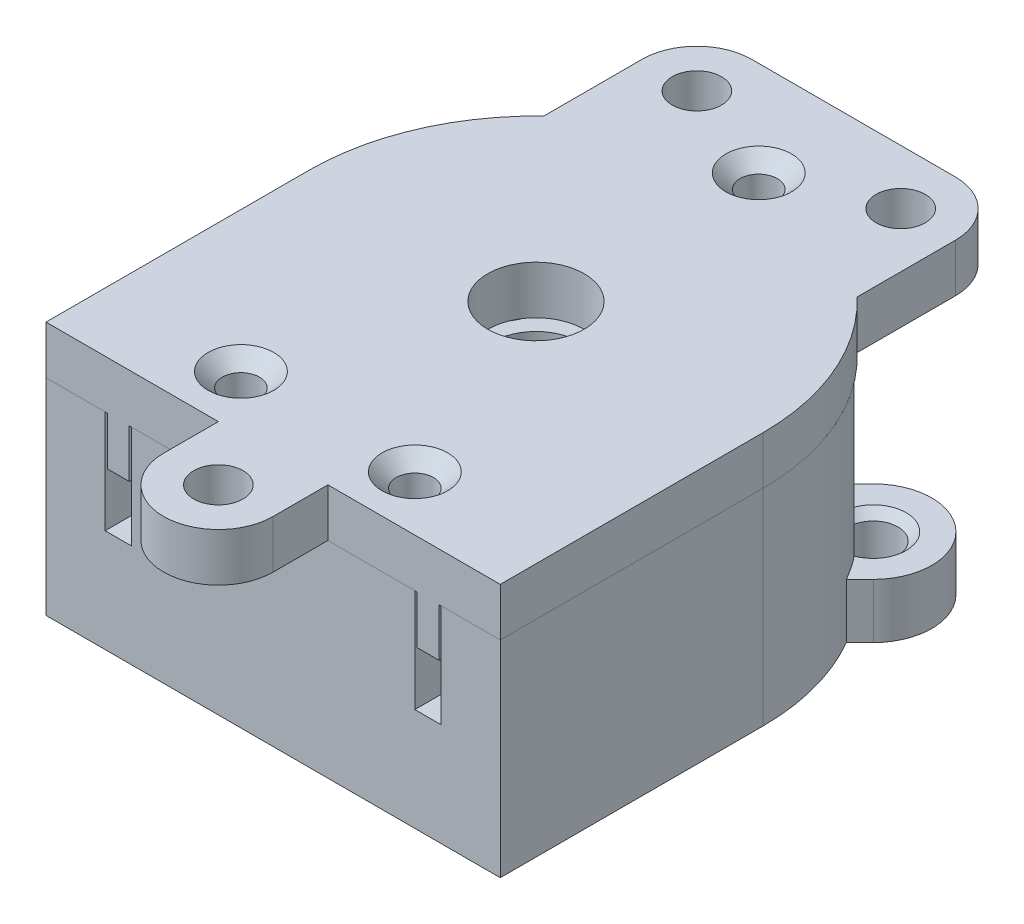
from build123d import *
from build123d.topology import SkipClean

# Parameters (mm, degrees)
BOSS_EXTRUDE1_DEPTH                         = 3.7
SKETCH2_R                                   = 1.25
SKETCH2_R_2                                 = 0.585
BOSS_EXTRUDE2_DEPTH                         = 1
BOSS_EXTRUDE2_2_DEPTH                       = 1
BOSS_EXTRUDE2_3_DEPTH                       = 1
BOSS_EXTRUDE3_START                         = 1.2
SKETCH4_R                                   = 6.435
BOSS_EXTRUDE3_DEPTH                         = 1.2
SKETCH5_R                                   = 6.435
BOSS_EXTRUDE4_DEPTH                         = 1.2
BOSS_EXTRUDE5_START                         = 1
SKETCH7_R                                   = 1.25
SKETCH7_R_2                                 = 0.585
BOSS_EXTRUDE5_DEPTH                         = 1
BOSS_EXTRUDE6_START                         = -1.6
BOSS_EXTRUDE6_DEPTH                         = 6.9
SKETCH9_R                                   = 10.37
SKETCH9_W                                   = 20.74
SKETCH9_H                                   = 12
BOSS_EXTRUDE7_DEPTH                         = 2.5
SKETCH10_R                                  = 10.37
SKETCH10_W                                  = 20.74
SKETCH10_H                                  = 12
BOSS_EXTRUDE8_DEPTH                         = 2.2
BOSS_EXTRUDE9_DEPTH                         = 2.5
SKETCH26_R                                  = 8.2
CUT_EXTRUDE4_DEPTH                          = 1.6
SKETCH27_R                                  = 2.2
CUT_EXTRUDE5_DEPTH                          = 19.285155181
SKETCH28_R                                  = 1.5
CUT_EXTRUDE6_DEPTH                          = 19.089414031
SKETCH30_R                                  = 6.635
BOSS_EXTRUDE10_DEPTH                        = 2.2
CUT_EXTRUDE3_START                          = -6.9
SKETCH25_R                                  = 1.6
CUT_EXTRUDE3_DEPTH                          = 9.1
CSK_FOR_1_FLAT_HEAD_MACHINE_SCREW_2_COUNT   = 2
CSK_FOR_1_FLAT_HEAD_MACHINE_SCREW_2_PITCH   = 7.304924281
CSK_FOR_1_FLAT_HEAD_MACHINE_SCREW_3_COUNT   = 2
CSK_FOR_1_FLAT_HEAD_MACHINE_SCREW_3_PITCH   = 7.304924281
CSK_FOR_1_FLAT_HEAD_MACHINE_SCREW_4_A_COUNT = 2
CSK_FOR_1_FLAT_HEAD_MACHINE_SCREW_4_A_PITCH = 15.4
CSK_FOR_1_FLAT_HEAD_MACHINE_SCREW_5_COUNT   = 2
CSK_FOR_1_FLAT_HEAD_MACHINE_SCREW_5_PITCH   = 21.778888861
CSK_FOR_1_FLAT_HEAD_MACHINE_SCREW_6_COUNT   = 2
CSK_FOR_1_FLAT_HEAD_MACHINE_SCREW_6_PITCH   = 15.4
SKETCH36_R                                  = 7.57
SKETCH36_R_2                                = 6.735
BOSS_EXTRUDE11_DEPTH                        = 2.2
SKETCH37_R                                  = 2.2
CUT_EXTRUDE7_DEPTH                          = 2.2
FILLET1_R                                   = 1
SKETCH40_R                                  = 2.5
BOSS_EXTRUDE12_DEPTH                        = 2.2
BOSS_EXTRUDE13_REACH                        = 22.066
CSK_FOR_1_FLAT_HEAD_MACHINE_SCREW_7_A_COUNT = 2
CSK_FOR_1_FLAT_HEAD_MACHINE_SCREW_7_A_PITCH = 20.066633998
CSK_FOR_1_FLAT_HEAD_MACHINE_SCREW_8_COUNT   = 2
CSK_FOR_1_FLAT_HEAD_MACHINE_SCREW_8_PITCH   = 20.066633998
BOSS_EXTRUDE14_DEPTH                        = 2.2
BOSS_EXTRUDE15_DEPTH                        = 2.2


# Read off the part's stored shape, not the designer's step: Boss-Extrude6, CSK for #1 Flat Head Machine Screw (100)5
with BuildPart() as part:
    # Sketch1 → Boss-Extrude1 (new body)
    with BuildSketch(Plane(origin=(0, 0, 0), x_dir=(1, 0, 0), z_dir=(0, 1, 0))):
        with BuildLine():
            ThreePointArc((-1.322875656, -1.5), (-1.547786782, -1.266631784), (-1.732050808, -1))
            Line((-1.732050808, -1), (-2.598076211, -1.5))
            ThreePointArc((-2.598076211, -1.5), (-2.379793788, -2.026980386), (-2.305341719, -2.5925))
            ThreePointArc((-2.305341719, -2.5925), (-2.88570421, -4.075525106), (-4.318489055, -4.770731315))
            ThreePointArc((-4.318489055, -4.770731315), (0, -6.435), (4.318489055, -4.770731315))
            ThreePointArc((4.318489055, -4.770731315), (2.556545765, -3.609681503), (2.598076211, -1.5))
            Line((2.598076211, -1.5), (1.732050808, -1))
            ThreePointArc((1.732050808, -1), (1.547786782, -1.266631784), (1.322875656, -1.5))
            ThreePointArc((1.322875656, -1.5), (0, -2), (-1.322875656, -1.5))
        make_face()
        with BuildLine():
            Line((0, 3), (0, 2))
            ThreePointArc((0, 2), (1.414213562, 1.414213562), (2, 0))
            ThreePointArc((2, 0), (1.931851653, -0.51763809), (1.732050808, -1))
            Line((1.732050808, -1), (2.598076211, -1.5))
            ThreePointArc((2.598076211, -1.5), (4.404348764, -0.409192827), (6.290819041, -1.35455557))
            ThreePointArc((6.290819041, -1.35455557), (6.398853238, -0.681103689), (6.435, 0))
            ThreePointArc((6.435, 0), (5.201017615, 3.789279717), (1.972329986, 6.125286885))
            ThreePointArc((1.972329986, 6.125286885), (2.1311694, 5.667018662), (2.185, 5.185))
            ThreePointArc((2.185, 5.185), (1.545028317, 3.639971683), (0, 3))
        make_face()
        with BuildLine():
            ThreePointArc((-1.732050808, -1), (-1.732050808, 1), (0, 2))
            Line((0, 2), (0, 3))
            ThreePointArc((0, 3), (-1.847802999, 4.01887433), (-1.972329986, 6.125286885))
            ThreePointArc((-1.972329986, 6.125286885), (-5.572873473, 3.2175), (-6.290819041, -1.35455557))
            ThreePointArc((-6.290819041, -1.35455557), (-4.404348764, -0.409192827), (-2.598076211, -1.5))
            Line((-2.598076211, -1.5), (-1.732050808, -1))
        make_face()
        with BuildLine():
            Line((1.322875656, -1.5), (0, -1.5))
            Line((0, -1.5), (-1.322875656, -1.5))
            ThreePointArc((-1.322875656, -1.5), (0, -2), (1.322875656, -1.5))
        make_face()
    extrude(amount=BOSS_EXTRUDE1_DEPTH)



with BuildPart() as body_2:
    # Sketch2 → Boss-Extrude2 (new body)
    with BuildSketch(Plane.XZ):
        with Locations(Location((-4.490341719, 2.5925, 0), (0, 0, 270))):
            Circle(SKETCH2_R)
        with Locations(Location((-4.490341719, 2.5925, 0), (0, 0, 270))):
            Circle(SKETCH2_R_2, mode=Mode.SUBTRACT)
    extrude(amount=-BOSS_EXTRUDE2_DEPTH)


with BuildPart() as body_3:
    # Sketch2 → Boss-Extrude2 2 (new body)
    with BuildSketch(Plane.XZ):
        with Locations(Location((4.490341719, 2.5925, 0), (0, 0, 270))):
            Circle(SKETCH2_R)
        with Locations(Location((4.490341719, 2.5925, 0), (0, 0, 270))):
            Circle(SKETCH2_R_2, mode=Mode.SUBTRACT)
    extrude(amount=-BOSS_EXTRUDE2_2_DEPTH)


with BuildPart() as body_4:
    # Sketch2 → Boss-Extrude2 3 (new body)
    with BuildSketch(Plane.XZ):
        with Locations(Location((0, -5.185, 0), (0, 0, 270))):
            Circle(SKETCH2_R)
        with Locations(Location((0, -5.185, 0), (0, 0, 270))):
            Circle(SKETCH2_R_2, mode=Mode.SUBTRACT)
    extrude(amount=-BOSS_EXTRUDE2_3_DEPTH)


with BuildPart() as part_1:
    with SkipClean():  # the faces are left unmerged after this step: merging them gives an invalid solid
        add(part.part)

        add(body_2.part)  # Boss-Extrude3 merges body 2

        add(body_3.part)  # Boss-Extrude3 merges body 3

        add(body_4.part)  # Boss-Extrude3 merges body 4
        # Sketch4 → Boss-Extrude3 (add)
        with BuildSketch(Plane.XZ.offset(BOSS_EXTRUDE3_START)):
            with Locations(Location((0, 0, 0), (0, 0, 270))):
                Circle(SKETCH4_R)
        extrude(amount=-BOSS_EXTRUDE3_DEPTH)


with BuildPart() as body_2_2:
    # Sketch5 → Boss-Extrude4 (new body)
    with BuildSketch(Plane(origin=(0, 3.7, 0), x_dir=(1, 0, 0), z_dir=(0, 1, 0))):
        with Locations(Location((0, 0, 0), (0, 0, 270))):
            Circle(SKETCH5_R)
    extrude(amount=BOSS_EXTRUDE4_DEPTH)

    # Sketch7 → Boss-Extrude5 (add)
    # profile 1 of 3: a face of its own
    with BuildSketch(Plane.XZ.offset(-3.7).offset(BOSS_EXTRUDE5_START)):
        with Locations(Location((0, -5.185, 0), (0, 0, 270))):
            Circle(SKETCH7_R)
        with Locations(Location((0, -5.185, 0), (0, 0, 270))):
            Circle(SKETCH7_R_2, mode=Mode.SUBTRACT)
    # profile 2 of 3: a face of its own
    with BuildSketch(Plane.XZ.offset(-3.7).offset(BOSS_EXTRUDE5_START)):
        with Locations(Location((-4.490341719, 2.5925, 0), (0, 0, 149.999192618))):
            Circle(SKETCH7_R)
        with Locations(Location((-4.490341719, 2.5925, 0), (0, 0, 270))):
            Circle(SKETCH7_R_2, mode=Mode.SUBTRACT)
    # profile 3 of 3: a face of its own
    with BuildSketch(Plane.XZ.offset(-3.7).offset(BOSS_EXTRUDE5_START)):
        with Locations(Location((4.490341719, 2.5925, 0), (0, 0, 29.999192618))):
            Circle(SKETCH7_R)
        with Locations(Location((4.490341719, 2.5925, 0), (0, 0, 270))):
            Circle(SKETCH7_R_2, mode=Mode.SUBTRACT)
    extrude(amount=-BOSS_EXTRUDE5_DEPTH)


with BuildPart() as body_3_2:
    # Boss-Extrude6 outline → Boss-Extrude6 (new body)
    with BuildSketch(Plane(origin=(0, 0, 0), x_dir=(1, 0, 0), z_dir=(0, 1, 0)).offset(BOSS_EXTRUDE6_START)):
        with BuildLine():
            Line((-10.37, -12), (-7.67, -12))
            Line((-7.67, -12), (-7.67, 0))
            ThreePointArc((-7.67, 0), (0, 7.67), (7.67, 0))
            Line((7.67, 0), (7.67, -12))
            Line((7.67, -12), (10.37, -12))
            Line((10.37, -12), (10.37, 0))
            ThreePointArc((10.37, 0), (0, 10.37), (-10.37, 0))
            Line((-10.37, 0), (-10.37, -12))
        make_face()
        with BuildLine():
            Line((6.47, -12), (6.47, -4.119223228))
            ThreePointArc((6.47, -4.119223228), (0, -7.67), (-6.47, -4.119223228))
            Line((-6.47, -4.119223228), (-6.47, -12))
            Line((-6.47, -12), (6.47, -12))
        make_face()
    extrude(amount=BOSS_EXTRUDE6_DEPTH)

    # Sketch9 → Boss-Extrude7 (add)
    with BuildSketch(Plane(origin=(0, -1.6, 0), x_dir=(1, 0, 0), z_dir=(0, 1, 0))):
        Circle(SKETCH9_R)
        with Locations((0, -6)):
            Rectangle(SKETCH9_W, SKETCH9_H)
    extrude(amount=-BOSS_EXTRUDE7_DEPTH)

    # Sketch24 → Boss-Extrude9 (add)
    with BuildSketch(Plane.XZ.offset(4.1)):
        with BuildLine():
            ThreePointArc((-8.903418523, -5.316581477), (-9.265421569, -5.537049397), (-9.587975106, -5.812024894))
            Line((-9.587975106, -5.812024894), (-5.812024894, -9.587975106))
            ThreePointArc((-5.812024894, -9.587975106), (-5.537049397, -9.265421569), (-5.316581477, -8.903418523))
            ThreePointArc((-5.316581477, -8.903418523), (-7.332697321, -7.332697321), (-8.903418523, -5.316581477))
        make_face()
        with BuildLine():
            Line((-8.973453212, -5.197503001), (-9.587975106, -5.812024894))
            ThreePointArc((-9.587975106, -5.812024894), (-9.265421569, -5.537049397), (-8.903418523, -5.316581477))
            ThreePointArc((-8.903418523, -5.316581477), (-8.938634162, -5.257158863), (-8.973453212, -5.197503001))
        make_face()
        with BuildLine():
            ThreePointArc((-5.316581477, -8.903418523), (-5.537049397, -9.265421569), (-5.812024894, -9.587975106))
            Line((-5.812024894, -9.587975106), (-5.197503001, -8.973453212))
            ThreePointArc((-5.197503001, -8.973453212), (-5.257158863, -8.938634162), (-5.316581477, -8.903418523))
        make_face()
        with BuildLine():
            Line((-5.812024894, -9.587975106), (-9.587975106, -5.812024894))
            ThreePointArc((-9.587975106, -5.812024894), (-9.587975106, -9.587975106), (-5.812024894, -9.587975106))
        make_face()
        with BuildLine():
            ThreePointArc((8.903418523, -5.316581477), (9.265421569, -5.537049397), (9.587975106, -5.812024894))
            Line((9.587975106, -5.812024894), (8.973453212, -5.197503001))
            ThreePointArc((8.973453212, -5.197503001), (8.938634162, -5.257158863), (8.903418523, -5.316581477))
        make_face()
        with BuildLine():
            ThreePointArc((5.316581477, -8.903418523), (5.537049397, -9.265421569), (5.812024894, -9.587975106))
            Line((5.812024894, -9.587975106), (9.587975106, -5.812024894))
            ThreePointArc((9.587975106, -5.812024894), (9.265421569, -5.537049397), (8.903418523, -5.316581477))
            ThreePointArc((8.903418523, -5.316581477), (7.332697321, -7.332697321), (5.316581477, -8.903418523))
        make_face()
        with BuildLine():
            ThreePointArc((5.316581477, -8.903418523), (5.257158863, -8.938634162), (5.197503001, -8.973453212))
            Line((5.197503001, -8.973453212), (5.812024894, -9.587975106))
            ThreePointArc((5.812024894, -9.587975106), (5.537049397, -9.265421569), (5.316581477, -8.903418523))
        make_face()
        with BuildLine():
            Line((9.587975106, -5.812024894), (5.812024894, -9.587975106))
            ThreePointArc((5.812024894, -9.587975106), (8.721764764, -10.166758352), (10.37, -7.7))
            ThreePointArc((10.37, -7.7), (10.166758352, -6.678235236), (9.587975106, -5.812024894))
        make_face()
    extrude(amount=-BOSS_EXTRUDE9_DEPTH)

    # Sketch26 → Cut-Extrude4 (cut)
    with BuildSketch(Plane.XZ.offset(4.1)):
        with Locations(Location((0, 0, 0), (0, 0, 270))):
            Circle(SKETCH26_R)
    extrude(amount=-CUT_EXTRUDE4_DEPTH, mode=Mode.SUBTRACT)

    # Sketch27 → Cut-Extrude5 (cut, through all)
    with BuildSketch(Plane(origin=(0, -1.6, 0), x_dir=(1, 0, 0), z_dir=(0, 1, 0))):
        with Locations(Location((0, 0, 0), (0, 0, 270))):
            Circle(SKETCH27_R)
    extrude(amount=-CUT_EXTRUDE5_DEPTH, mode=Mode.SUBTRACT)

    # Sketch30 → Boss-Extrude10 (add)
    # profile 1 of 3: a face of its own
    with BuildSketch(Plane(origin=(0, -1.6, 0), x_dir=(1, 0, 0), z_dir=(0, 1, 0))):
        with BuildLine():
            ThreePointArc((-6.47, -4.119223228), (-7.363891634, -2.145227261), (-7.67, 0))
            Line((-7.67, 0), (-7.67, -12))
            Line((-7.67, -12), (-6.47, -12))
            Line((-6.47, -12), (-6.47, -4.119223228))
        make_face()
    # profile 2 of 3: a face of its own
    with BuildSketch(Plane(origin=(0, -1.6, 0), x_dir=(1, 0, 0), z_dir=(0, 1, 0))):
        with BuildLine():
            ThreePointArc((7.67, 0), (0, 7.67), (-7.67, 0))
            ThreePointArc((-7.67, 0), (-7.363891634, -2.145227261), (-6.47, -4.119223228))
            ThreePointArc((-6.47, -4.119223228), (0, -7.67), (6.47, -4.119223228))
            ThreePointArc((6.47, -4.119223228), (7.363891634, -2.145227261), (7.67, 0))
        make_face()
        with Locations(Location((0, 0, 0), (0, 0, 270))):
            Circle(SKETCH30_R, mode=Mode.SUBTRACT)
    # profile 3 of 3: a face of its own
    with BuildSketch(Plane(origin=(0, -1.6, 0), x_dir=(1, 0, 0), z_dir=(0, 1, 0))):
        with BuildLine():
            Line((7.67, -12), (7.67, 0))
            ThreePointArc((7.67, 0), (7.363891634, -2.145227261), (6.47, -4.119223228))
            Line((6.47, -4.119223228), (6.47, -12))
            Line((6.47, -12), (7.67, -12))
        make_face()
    extrude(amount=BOSS_EXTRUDE10_DEPTH)

    # Sketch25 → Cut-Extrude3 (cut)
    with BuildSketch(Plane(origin=(0, 5.3, 0), x_dir=(1, 0, 0), z_dir=(0, 1, 0)).offset(CUT_EXTRUDE3_START)):
        with Locations((-7.7, 7.7)):
            Circle(SKETCH25_R)
        with Locations((7.7, 7.7)):
            Circle(SKETCH25_R)
        with Locations(Location((7.7, -7.7, 0), (0, 0, 270))):
            Circle(SKETCH25_R)
        with Locations(Location((-7.7, -7.7, 0), (0, 0, 270))):
            Circle(SKETCH25_R)
    extrude(amount=CUT_EXTRUDE3_DEPTH, mode=Mode.SUBTRACT)

    # Sketch34 → CSK for _1 Flat Head Machine Screw _ 4 (revolve, cut)
    with BuildSketch(Plane(origin=(-7.7, -1.6, 7.7), x_dir=(0, 0, 1), z_dir=(1, 0, 0))):
        Polygon((0, 0), (0, 4.1), (1.125000036, 4.1), (1.125000036, 0.374999504), (1.49999954, 0), align=None)
    csk_for_1_flat_head_machine_screw_4 = revolve(axis=Axis((-7.7, 4.75, 7.7), (0, -1, 0)), mode=Mode.SUBTRACT)

    # CSK for _1 Flat Head Machine Screw _ 4 a: CSK for _1 Flat Head Machine Screw _ 4 ×2
    with Locations(*[(0, 0, -i * CSK_FOR_1_FLAT_HEAD_MACHINE_SCREW_4_A_PITCH) for i in range(1, CSK_FOR_1_FLAT_HEAD_MACHINE_SCREW_4_A_COUNT)]):
        add(csk_for_1_flat_head_machine_screw_4, mode=Mode.SUBTRACT)

    # CSK for _1 Flat Head Machine Screw _ 5: CSK for _1 Flat Head Machine Screw _ 4 ×2
    with Locations(*[Vector(0.7071067811865476, 0, -0.7071067811865476) * (i * CSK_FOR_1_FLAT_HEAD_MACHINE_SCREW_5_PITCH) for i in range(1, CSK_FOR_1_FLAT_HEAD_MACHINE_SCREW_5_COUNT)]):
        add(csk_for_1_flat_head_machine_screw_4, mode=Mode.SUBTRACT)

    # CSK for _1 Flat Head Machine Screw _ 6: CSK for _1 Flat Head Machine Screw _ 4 ×2
    with Locations(*[(i * CSK_FOR_1_FLAT_HEAD_MACHINE_SCREW_6_PITCH, 0, 0) for i in range(1, CSK_FOR_1_FLAT_HEAD_MACHINE_SCREW_6_COUNT)]):
        add(csk_for_1_flat_head_machine_screw_4, mode=Mode.SUBTRACT)

    # Fillet1
    # the kernel refuses this fillet: 1 mm, written as the material it takes off along each edge
    with BuildSketch(Plane(origin=(6.47, 0.6, 4.119223228), x_dir=(0, 0, 1), z_dir=(0, 1, 0))) as fillet1_piece_1:
        with BuildLine():
            CenterArc((2.606464472, -0.99880041), FILLET1_R, 92.806710124, 126.320888755)
            Line((1.830721946, -1.629849959), (1.815207096, -1.64247095))
            ThreePointArc((1.815207096, -1.64247095), (0.967589756, -0.756259223), (-0.01074113, -0.016870926))
            Line((-0.01074113, -0.016870926), (0, 0.02))
            ThreePointArc((0, 0.02), (1.278748864, 0.02), (2.556518394, 0.019976008))
            Line((2.556518394, 0.019976008), (2.557497729, 0))
        make_face()
    extrude(amount=11.093744322, mode=Mode.SUBTRACT)
    with BuildSketch(Plane(origin=(-6.47, 0.6, 4.119223228), x_dir=(0, 0, 1), z_dir=(0, 1, 0))) as fillet1_piece_2:
        with BuildLine():
            CenterArc((2.606464472, 0.99880041), FILLET1_R, 140.872401121, 126.320888755)
            Line((1.830721946, 1.629849959), (1.815207096, 1.64247095))
            ThreePointArc((1.815207096, 1.64247095), (0.967589756, 0.756259223), (-0.01074113, 0.016870926))
            Line((-0.01074113, 0.016870926), (0, -0.02))
            ThreePointArc((0, -0.02), (1.278748864, -0.02), (2.556518394, -0.019976008))
            Line((2.556518394, -0.019976008), (2.557497729, 0))
        make_face()
    extrude(amount=11.093744322, mode=Mode.SUBTRACT)



with BuildPart() as body_4_2:
    # Sketch10 → Boss-Extrude8 (new body)
    with BuildSketch(Plane(origin=(0, 5.3, 0), x_dir=(1, 0, 0), z_dir=(0, 1, 0))):
        Circle(SKETCH10_R)
        with Locations((0, -6)):
            Rectangle(SKETCH10_W, SKETCH10_H)
    extrude(amount=BOSS_EXTRUDE8_DEPTH)


with BuildPart() as cut_extrude6_tool:
    # Sketch28 → Cut-Extrude6 (new, through all)
    # profile 1 of 2: a face of its own
    with SkipClean():  # the faces are left unmerged after this step: merging them gives an invalid solid
        with BuildSketch(Plane.XZ.offset(1.2)):
            with BuildLine():
                Line((0, 1.5), (-1.322875656, 1.5))
                ThreePointArc((-1.322875656, 1.5), (-0.822875656, -1.822875656), (2, 0))
                ThreePointArc((2, 0), (1.822875656, 0.822875656), (1.322875656, 1.5))
                Line((1.322875656, 1.5), (0, 1.5))
            make_face()
            with BuildLine():
                ThreePointArc((1.5, 0), (-1.060660172, -1.060660172), (0, 1.5))
                ThreePointArc((0, 1.5), (1.060660172, 1.060660172), (1.5, 0))
            make_face(mode=Mode.SUBTRACT)
        # profile 2 of 2: a face of its own
        with BuildSketch(Plane.XZ.offset(1.2)):
            Circle(SKETCH28_R)
        extrude(amount=-CUT_EXTRUDE6_DEPTH)


with BuildPart() as part_2:
    with SkipClean():  # the faces are left unmerged after this step: merging them gives an invalid solid
        add(part_1.part)

        # Cut-Extrude6: cut by cut_extrude6_tool
        add(cut_extrude6_tool.part, mode=Mode.SUBTRACT)


with BuildPart() as body_2_2_1:
    with SkipClean():  # the faces are left unmerged after this step: merging them gives an invalid solid
        add(body_2_2.part)

        # Cut-Extrude6: cut by cut_extrude6_tool
        add(cut_extrude6_tool.part, mode=Mode.SUBTRACT)


with BuildPart() as body_4_2_1:
    with SkipClean():  # the faces are left unmerged after this step: merging them gives an invalid solid
        add(body_4_2.part)

        # Cut-Extrude6: cut by cut_extrude6_tool
        add(cut_extrude6_tool.part, mode=Mode.SUBTRACT)

    # Sketch36 → Boss-Extrude11 (add)
    # profile 1 of 3: a face of its own
    with BuildSketch(Plane.XZ.offset(-5.3)):
        with BuildLine():
            Line((-7.57, 12), (-7.57, 0))
            ThreePointArc((-7.57, 0), (-7.315729629, 1.945507646), (-6.57, 3.760319135))
            Line((-6.57, 3.760319135), (-6.57, 12))
            Line((-6.57, 12), (-7.57, 12))
        make_face()
    # profile 2 of 3: a face of its own
    with BuildSketch(Plane.XZ.offset(-5.3)):
        Circle(SKETCH36_R)
        with Locations(Location((0, 0, 0), (0, 0, 270))):
            Circle(SKETCH36_R_2, mode=Mode.SUBTRACT)
    # profile 3 of 3: a face of its own
    with BuildSketch(Plane.XZ.offset(-5.3)):
        with BuildLine():
            ThreePointArc((6.57, 3.760319135), (7.315729629, 1.945507646), (7.57, 0))
            Line((7.57, 0), (7.57, 12))
            Line((7.57, 12), (6.57, 12))
            Line((6.57, 12), (6.57, 3.760319135))
        make_face()
    extrude(amount=BOSS_EXTRUDE11_DEPTH)

    # Sketch37 → Cut-Extrude7 (cut)
    with BuildSketch(Plane(origin=(0, 7.5, 0), x_dir=(1, 0, 0), z_dir=(0, 1, 0))):
        with Locations(Location((0, 0, 0), (0, 0, 270))):
            Circle(SKETCH37_R)
    extrude(amount=-CUT_EXTRUDE7_DEPTH, mode=Mode.SUBTRACT)

    # Sketch40 → Boss-Extrude12 (add)
    with BuildSketch(Plane(origin=(0, 7.5, 0), x_dir=(1, 0, 0), z_dir=(0, 1, 0))):
        with Locations((0, 10.17)):
            Circle(SKETCH40_R)
    extrude(amount=-BOSS_EXTRUDE12_DEPTH)


with BuildPart() as csk_for_1_flat_head_machine_screw_100_tool:
    # Sketch32 → CSK for _1 Flat Head Machine Screw _100 (revolve)
    with SkipClean():  # the faces are left unmerged after this step: merging them gives an invalid solid
        with BuildSketch(Plane(origin=(0, 4.9, 4.2175), x_dir=(0, 0, 1), z_dir=(1, 0, 0))):
            Polygon((0, 0), (0, 4.1), (0.849999951, 4.1), (0.849999951, 0.649999589), (1.49999954, 0), align=None)
        csk_for_1_flat_head_machine_screw_100 = revolve(axis=Axis((0, 11.25, 4.2175), (0, -1, 0)))


with BuildPart() as part_3:
    with SkipClean():  # the faces are left unmerged after this step: merging them gives an invalid solid
        add(part_2.part)

        # CSK for _1 Flat Head Machine Screw _100: cut by csk_for_1_flat_head_machine_screw_100_tool
        add(csk_for_1_flat_head_machine_screw_100_tool.part, mode=Mode.SUBTRACT)


with BuildPart() as body_2_2_2:
    with SkipClean():  # the faces are left unmerged after this step: merging them gives an invalid solid
        add(body_2_2_1.part)

        # CSK for _1 Flat Head Machine Screw _100: cut by csk_for_1_flat_head_machine_screw_100_tool
        add(csk_for_1_flat_head_machine_screw_100_tool.part, mode=Mode.SUBTRACT)


with BuildPart() as csk_for_1_flat_head_machine_screw_2_tool:
    # CSK for _1 Flat Head Machine Screw _ 2: CSK for _1 Flat Head Machine Screw _100 ×2
    with SkipClean():  # the faces are left unmerged after this step: merging them gives an invalid solid
        with Locations(*[Vector(-0.49999999999999806, 0, -0.8660254037844398) * (i * CSK_FOR_1_FLAT_HEAD_MACHINE_SCREW_2_PITCH) for i in range(1, CSK_FOR_1_FLAT_HEAD_MACHINE_SCREW_2_COUNT)]):
            add(csk_for_1_flat_head_machine_screw_100)


with BuildPart() as part_4:
    with SkipClean():  # the faces are left unmerged after this step: merging them gives an invalid solid
        add(part_3.part)

        # CSK for _1 Flat Head Machine Screw _ 2: cut by csk_for_1_flat_head_machine_screw_2_tool
        add(csk_for_1_flat_head_machine_screw_2_tool.part, mode=Mode.SUBTRACT)


with BuildPart() as body_2_2_3:
    with SkipClean():  # the faces are left unmerged after this step: merging them gives an invalid solid
        add(body_2_2_2.part)

        # CSK for _1 Flat Head Machine Screw _ 2: cut by csk_for_1_flat_head_machine_screw_2_tool
        add(csk_for_1_flat_head_machine_screw_2_tool.part, mode=Mode.SUBTRACT)


with BuildPart() as csk_for_1_flat_head_machine_screw_3_tool:
    # CSK for _1 Flat Head Machine Screw _ 3: CSK for _1 Flat Head Machine Screw _100 ×2
    with SkipClean():  # the faces are left unmerged after this step: merging them gives an invalid solid
        with Locations(*[Vector(0.49999999999999784, 0, -0.8660254037844399) * (i * CSK_FOR_1_FLAT_HEAD_MACHINE_SCREW_3_PITCH) for i in range(1, CSK_FOR_1_FLAT_HEAD_MACHINE_SCREW_3_COUNT)]):
            add(csk_for_1_flat_head_machine_screw_100)


with BuildPart() as part_5:
    with SkipClean():  # the faces are left unmerged after this step: merging them gives an invalid solid
        add(part_4.part)

        # CSK for _1 Flat Head Machine Screw _ 3: cut by csk_for_1_flat_head_machine_screw_3_tool
        add(csk_for_1_flat_head_machine_screw_3_tool.part, mode=Mode.SUBTRACT)


with BuildPart() as body_2_2_4:
    with SkipClean():  # the faces are left unmerged after this step: merging them gives an invalid solid
        add(body_2_2_3.part)

        # CSK for _1 Flat Head Machine Screw _ 3: cut by csk_for_1_flat_head_machine_screw_3_tool
        add(csk_for_1_flat_head_machine_screw_3_tool.part, mode=Mode.SUBTRACT)


with BuildPart() as body_3_2_1:
    add(body_3_2.part)

    # Sketch41 → Boss-Extrude13 (add, up to next)
    with BuildSketch(Plane.XZ.offset(4.1), mode=Mode.PRIVATE) as boss_extrude13_sk1:
        with BuildLine():
            ThreePointArc((2.497780987, -10.064690265), (1.258185588, -10.293389579), (0, -10.37))
            Line((0, -10.37), (0, -12.67))
            ThreePointArc((0, -12.67), (1.767766953, -11.937766953), (2.5, -10.17))
            ThreePointArc((2.5, -10.17), (2.499445185, -10.117333445), (2.497780987, -10.064690265))
        make_face()
    boss_extrude13_tool1 = extrude(boss_extrude13_sk1.sketch, amount=-BOSS_EXTRUDE13_REACH, mode=Mode.PRIVATE) - body_4_2_1.part
    # Sketch41 → Boss-Extrude13 (add, up to next)
    with BuildSketch(Plane.XZ.offset(4.1), mode=Mode.PRIVATE) as boss_extrude13_sk2:
        with BuildLine():
            Line((0, -12.67), (0, -10.37))
            ThreePointArc((0, -10.37), (-1.258185588, -10.293389579), (-2.497780987, -10.064690265))
            ThreePointArc((-2.497780987, -10.064690265), (-1.804615518, -11.900133761), (0, -12.67))
        make_face()
    boss_extrude13_tool2 = extrude(boss_extrude13_sk2.sketch, amount=-BOSS_EXTRUDE13_REACH, mode=Mode.PRIVATE) - body_4_2_1.part
    # Sketch41 → Boss-Extrude13 (add, up to next)
    with BuildSketch(Plane.XZ.offset(4.1), mode=Mode.PRIVATE) as boss_extrude13_sk3:
        with BuildLine():
            ThreePointArc((2.497780987, -10.064690265), (1.258185588, -10.293389579), (0, -10.37))
            Line((0, -10.37), (0, -12.67))
            ThreePointArc((0, -12.67), (1.767766953, -11.937766953), (2.5, -10.17))
            ThreePointArc((2.5, -10.17), (2.499445185, -10.117333445), (2.497780987, -10.064690265))
        make_face()
    boss_extrude13_tool3 = extrude(boss_extrude13_sk3.sketch, amount=-BOSS_EXTRUDE13_REACH, mode=Mode.PRIVATE) - body_4_2_1.part
    # Sketch41 → Boss-Extrude13 (add, up to next)
    with BuildSketch(Plane.XZ.offset(4.1), mode=Mode.PRIVATE) as boss_extrude13_sk4:
        with BuildLine():
            Line((0, -12.67), (0, -10.37))
            ThreePointArc((0, -10.37), (-1.258185588, -10.293389579), (-2.497780987, -10.064690265))
            ThreePointArc((-2.497780987, -10.064690265), (-1.804615518, -11.900133761), (0, -12.67))
        make_face()
    boss_extrude13_tool4 = extrude(boss_extrude13_sk4.sketch, amount=-BOSS_EXTRUDE13_REACH, mode=Mode.PRIVATE) - body_4_2_1.part
    add(boss_extrude13_tool1.solids().sort_by_distance((1.085079, -4.1, -11.282355))[0])
    add(boss_extrude13_tool2.solids().sort_by_distance((-1.085079, -4.1, -11.282355))[0])
    add(boss_extrude13_tool3.solids().sort_by_distance((1.085079, -4.1, -11.282355))[0])
    add(boss_extrude13_tool4.solids().sort_by_distance((-1.085079, -4.1, -11.282355))[0])


with BuildPart() as csk_for_1_flat_head_machine_screw_7_tool:
    # Sketch39 → CSK for _1 Flat Head Machine Screw _ 7 (revolve)
    with BuildSketch(Plane(origin=(0, 7.5, -10.17), x_dir=(0, 0, 1), z_dir=(1, 0, 0))):
        Polygon((0, 0), (0, 4.1), (0.849999951, 4.1), (0.849999951, 0.649999589), (1.49999954, 0), align=None)
    csk_for_1_flat_head_machine_screw_7 = revolve(axis=Axis((0, 13.85, -10.17), (0, -1, 0)))


with BuildPart() as body_3_2_2:
    add(body_3_2_1.part)

    # CSK for _1 Flat Head Machine Screw _ 7: cut by csk_for_1_flat_head_machine_screw_7_tool
    add(csk_for_1_flat_head_machine_screw_7_tool.part, mode=Mode.SUBTRACT)


with BuildPart() as body_4_2_2:
    add(body_4_2_1.part)

    # CSK for _1 Flat Head Machine Screw _ 7: cut by csk_for_1_flat_head_machine_screw_7_tool
    add(csk_for_1_flat_head_machine_screw_7_tool.part, mode=Mode.SUBTRACT)


with BuildPart() as csk_for_1_flat_head_machine_screw_7_a_tool:
    # CSK for _1 Flat Head Machine Screw _ 7 a: CSK for _1 Flat Head Machine Screw _ 7 ×2
    with Locations(*[Vector(-0.19784085365006632, 0, 0.9802341539790445) * (i * CSK_FOR_1_FLAT_HEAD_MACHINE_SCREW_7_A_PITCH) for i in range(1, CSK_FOR_1_FLAT_HEAD_MACHINE_SCREW_7_A_COUNT)]):
        add(csk_for_1_flat_head_machine_screw_7)


with BuildPart() as body_3_2_3:
    add(body_3_2_2.part)

    # CSK for _1 Flat Head Machine Screw _ 7 a: cut by csk_for_1_flat_head_machine_screw_7_a_tool
    add(csk_for_1_flat_head_machine_screw_7_a_tool.part, mode=Mode.SUBTRACT)


with BuildPart() as body_4_2_3:
    add(body_4_2_2.part)

    # CSK for _1 Flat Head Machine Screw _ 7 a: cut by csk_for_1_flat_head_machine_screw_7_a_tool
    add(csk_for_1_flat_head_machine_screw_7_a_tool.part, mode=Mode.SUBTRACT)


with BuildPart() as csk_for_1_flat_head_machine_screw_8_tool:
    # CSK for _1 Flat Head Machine Screw _ 8: CSK for _1 Flat Head Machine Screw _ 7 ×2
    with Locations(*[Vector(0.19784085365006682, 0, 0.9802341539790443) * (i * CSK_FOR_1_FLAT_HEAD_MACHINE_SCREW_8_PITCH) for i in range(1, CSK_FOR_1_FLAT_HEAD_MACHINE_SCREW_8_COUNT)]):
        add(csk_for_1_flat_head_machine_screw_7)


with BuildPart() as body_3_2_4:
    add(body_3_2_3.part)

    # CSK for _1 Flat Head Machine Screw _ 8: cut by csk_for_1_flat_head_machine_screw_8_tool
    add(csk_for_1_flat_head_machine_screw_8_tool.part, mode=Mode.SUBTRACT)


with BuildPart() as body_4_2_4:
    add(body_4_2_3.part)

    # CSK for _1 Flat Head Machine Screw _ 8: cut by csk_for_1_flat_head_machine_screw_8_tool
    add(csk_for_1_flat_head_machine_screw_8_tool.part, mode=Mode.SUBTRACT)

    # Sketch42 → Boss-Extrude14 (add)
    with BuildSketch(Plane.XZ.offset(-5.3)):
        with BuildLine():
            Line((-7.153348759, -7.507762751), (-7.153348759, -11.999301868))
            ThreePointArc((-7.153348759, -11.999301868), (-6.421115712, -13.767068821), (-4.653348759, -14.499301868))
            Line((-4.653348759, -14.499301868), (4.653348759, -14.499301868))
            ThreePointArc((4.653348759, -14.499301868), (6.421115712, -13.767068821), (7.153348759, -11.999301868))
            Line((7.153348759, -11.999301868), (7.153348759, -7.507762751))
            ThreePointArc((7.153348759, -7.507762751), (4.992048269, -9.089353887), (2.497780987, -10.064690265))
            ThreePointArc((2.497780987, -10.064690265), (1.804615518, -11.900133761), (0, -12.67))
            ThreePointArc((0, -12.67), (-1.804615518, -11.900133761), (-2.497780987, -10.064690265))
            ThreePointArc((-2.497780987, -10.064690265), (-4.992048269, -9.089353887), (-7.153348759, -7.507762751))
        make_face()
    extrude(amount=-BOSS_EXTRUDE14_DEPTH)

    # Sketch45 → Boss-Extrude15 (add)
    with BuildSketch(Plane.XZ.offset(-5.3)):
        with BuildLine():
            Line((-2.5, 12), (2.5, 12))
            Line((2.5, 12), (2.5, 14.5))
            ThreePointArc((2.5, 14.5), (0, 17), (-2.5, 14.5))
            Line((-2.5, 14.5), (-2.5, 12))
        make_face()
    extrude(amount=-BOSS_EXTRUDE15_DEPTH)

    # CSK for _1 Flat Head Machine Screw _ 9 o → CSK for _1 Flat Head Machine Screw _ 9 (revolve, cut)
    with BuildSketch(Plane.XY.offset(14.5)):
        Polygon((1.125000036, 5.674999504), (1.125000036, 7.5), (0, 7.5), (0, 5.3), (1.49999954, 5.3), align=None)
    revolve(axis=Axis((0, 0, 14.5), (0, 1, 0)), mode=Mode.SUBTRACT)

    # CSK for _1 Flat Head Machine Screw _ 10 → CSK for _1 Flat Head Machine Screw _ 9 2 (revolve, cut)
    with BuildSketch(Plane(origin=(4.653348759, 0, -11.999301868), x_dir=(1, 0, 0), z_dir=(0, 0, 1))):
        Polygon((1.125000036, 5.674999504), (1.125000036, 7.5), (0, 7.5), (0, 5.3), (1.49999954, 5.3), align=None)
    revolve(axis=Axis((4.653348759, 0, -11.999301868), (0, 1, 0)), mode=Mode.SUBTRACT)

    # CSK for _1 Flat Head Machine Screw _ 11 → CSK for _1 Flat Head Machine Screw _ 9 3 (revolve, cut)
    with BuildSketch(Plane(origin=(-4.653348759, 0, -11.999301868), x_dir=(1, 0, 0), z_dir=(0, 0, 1))):
        Polygon((1.125000036, 5.674999504), (1.125000036, 7.5), (0, 7.5), (0, 5.3), (1.49999954, 5.3), align=None)
    revolve(axis=Axis((-4.653348759, 0, -11.999301868), (0, 1, 0)), mode=Mode.SUBTRACT)


solid = Compound([part_5.part, body_2_2_4.part, body_3_2_4.part, body_4_2_4.part])
